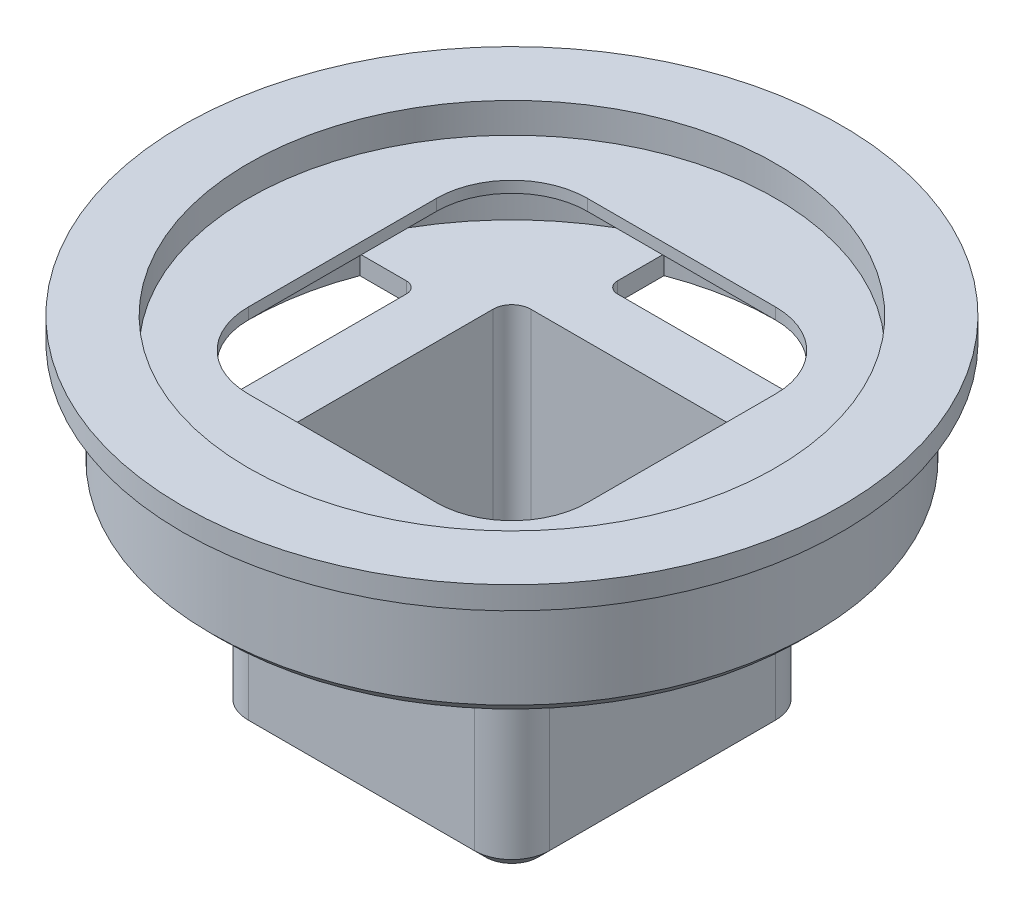
from build123d import *

# Parameters (mm, degrees)
SKETCH1_R                                           = 80
BOSS_EXTRUDE1_DEPTH                                 = 25
SKETCH2_R                                           = 80
SKETCH2_R_2                                         = 70
BOSS_EXTRUDE2_DEPTH                                 = 5
SKETCH3_R                                           = 87.5
SKETCH3_R_2                                         = 70
BOSS_EXTRUDE3_DEPTH                                 = 6
SKETCH5_W                                           = 80
SKETCH5_H                                           = 80
BOSS_EXTRUDE4_DEPTH                                 = 55
SHELL1_START                                        = -50
SHELL1_OUTLINE_W                                    = 70
SHELL1_OUTLINE_H                                    = 70
SHELL1_DEPTH                                        = 75
SHELL1_START_2                                      = 5
SHELL1_2_OUTLINE_R                                  = 75
SHELL1_2_OUTLINE_W                                  = 70
SHELL1_2_OUTLINE_H                                  = 70
SHELL1_2_DEPTH                                      = 20
F_6_3_6_3_DIAMETER_HOLE1_D                          = 6.3
F_6_3_6_3_DIAMETER_HOLE1_DEPTH                      = 10
F_6_3_6_3_DIAMETER_HOLE1_TIP                        = 1.89271095
SKETCH9_R                                           = 5.623813335
BOSS_EXTRUDE5_DEPTH                                 = 5
SKETCH11_R                                          = 70
BOSS_EXTRUDE6_DEPTH                                 = 3
CUT_EXTRUDE2_DEPTH                                  = 6
FILLET2_R                                           = 3
SKETCH18_R                                          = 15.880068884
BOSS_EXTRUDE9_DEPTH                                 = 5
SKETCH19_R                                          = 10
BOSS_EXTRUDE10_DEPTH                                = 10
CBORE_FOR_M6_HEX_SOCKET_HEAD_CAP_SCREW1_D           = 6.6
CBORE_FOR_M6_HEX_SOCKET_HEAD_CAP_SCREW1_CBORE_D     = 11
CBORE_FOR_M6_HEX_SOCKET_HEAD_CAP_SCREW1_CBORE_DEPTH = 6.4
FILLET7_R                                           = 10
FILLET8_R                                           = 5
CHAMFER1_SIZE                                       = 3


# Read off the part's stored shape, not the designer's step: Shell1
with BuildPart() as part:
    # Sketch1 → Boss-Extrude1 (new body)
    with BuildSketch(Plane(origin=(0, 0, 0), x_dir=(1, 0, 0), z_dir=(0, 1, 0))):
        with Locations(Location((0, 0, 0), (0, 0, 270))):
            Circle(SKETCH1_R)
    extrude(amount=BOSS_EXTRUDE1_DEPTH)

    # Sketch2 → Boss-Extrude2 (add)
    with BuildSketch(Plane(origin=(0, 25, 0), x_dir=(1, 0, 0), z_dir=(0, 1, 0))):
        with Locations(Location((0, 0, 0), (0, 0, 270))):
            Circle(SKETCH2_R)
        with Locations(Location((0, 0, 0), (0, 0, 270))):
            Circle(SKETCH2_R_2, mode=Mode.SUBTRACT)
    extrude(amount=BOSS_EXTRUDE2_DEPTH)

    # Sketch3 → Boss-Extrude3 (add)
    with BuildSketch(Plane(origin=(0, 30, 0), x_dir=(1, 0, 0), z_dir=(0, 1, 0))):
        with Locations(Location((0, 0, 0), (0, 0, 270))):
            Circle(SKETCH3_R)
        with Locations(Location((0, 0, 0), (0, 0, 270))):
            Circle(SKETCH3_R_2, mode=Mode.SUBTRACT)
    extrude(amount=BOSS_EXTRUDE3_DEPTH)

    # Sketch5 → Boss-Extrude4 (add)
    with BuildSketch(Plane.XZ):
        Rectangle(SKETCH5_W, SKETCH5_H)
    extrude(amount=BOSS_EXTRUDE4_DEPTH)

    # Shell1 outline → Shell1 (cut)
    with BuildSketch(Plane(origin=(0, 0, 0), x_dir=(1, 0, 0), z_dir=(0, 1, 0)).offset(SHELL1_START)):
        Rectangle(SHELL1_OUTLINE_W, SHELL1_OUTLINE_H)
    extrude(amount=SHELL1_DEPTH, mode=Mode.SUBTRACT)

    # Shell1 2 outline → Shell1 2 (cut)
    with BuildSketch(Plane(origin=(0, 0, 0), x_dir=(1, 0, 0), z_dir=(0, 1, 0)).offset(SHELL1_START_2)):
        Circle(SHELL1_2_OUTLINE_R)
        Rectangle(SHELL1_2_OUTLINE_W, SHELL1_2_OUTLINE_H, mode=Mode.SUBTRACT)
    extrude(amount=SHELL1_2_DEPTH, mode=Mode.SUBTRACT)

    # Ø6.3 (6.3) Diameter Hole1
    with Locations(Plane(origin=(0, -50, 0), x_dir=(1, 0, 0), z_dir=(0, 1, 0))):
        with Locations((0, 0), (24, -24), (-24, 24), (-24, -24), (24, 24), (8, -8), (-8, 8), (-8, -8), (8, 8), (8, 24), (24, 8), (-8, 24), (-24, 8), (-24, -8), (-8, -24), (8, -24), (24, -8)):
            Hole(F_6_3_6_3_DIAMETER_HOLE1_D / 2, depth=F_6_3_6_3_DIAMETER_HOLE1_DEPTH)
            with Locations((0, 0, -(F_6_3_6_3_DIAMETER_HOLE1_DEPTH + F_6_3_6_3_DIAMETER_HOLE1_TIP / 2))):  # 118° drill point
                Cone(0, F_6_3_6_3_DIAMETER_HOLE1_D / 2, F_6_3_6_3_DIAMETER_HOLE1_TIP, mode=Mode.SUBTRACT)

    # Sketch9 → Boss-Extrude5 (add)
    with BuildSketch(Plane(origin=(0, -50, 0), x_dir=(1, 0, 0), z_dir=(0, 1, 0))):
        Circle(SKETCH9_R)
    extrude(amount=-BOSS_EXTRUDE5_DEPTH)

    # Sketch11 → Boss-Extrude6 (add)
    with BuildSketch(Plane(origin=(0, 25, 0), x_dir=(1, 0, 0), z_dir=(0, 1, 0))):
        with Locations(Location((0, 0, 0), (0, 0, 270))):
            Circle(SKETCH11_R)
        with BuildLine():
            Line((-45, 25), (-45, -25))
            ThreePointArc((-45, -25), (-39.142135624, -39.142135624), (-25, -45))
            Line((-25, -45), (25, -45))
            ThreePointArc((25, -45), (39.142135624, -39.142135624), (45, -25))
            Line((45, -25), (45, 25))
            ThreePointArc((45, 25), (39.142135624, 39.142135624), (25, 45))
            Line((25, 45), (-25, 45))
            ThreePointArc((-25, 45), (-39.142135624, 39.142135624), (-45, 25))
        make_face(mode=Mode.SUBTRACT)
    extrude(amount=BOSS_EXTRUDE6_DEPTH)

    # Sketch12 → Cut-Extrude2 (cut)
    with BuildSketch(Plane.XZ):
        with BuildLine():
            Line((-50, 25), (-65.383484153, 25))
            ThreePointArc((-65.383484153, 25), (-70, 0), (-65.383484153, -25))
            Line((-65.383484153, -25), (-50, -25))
            Line((-50, -25), (-50, 25))
        make_face()
        with BuildLine():
            Line((-25, 50), (-25, 65.383484153))
            ThreePointArc((-25, 65.383484153), (0, 70), (25, 65.383484153))
            Line((25, 65.383484153), (25, 50))
            Line((25, 50), (-25, 50))
        make_face()
        with BuildLine():
            Line((50, 25), (65.383484153, 25))
            ThreePointArc((65.383484153, 25), (70, 0), (65.383484153, -25))
            Line((65.383484153, -25), (50, -25))
            Line((50, -25), (50, 25))
        make_face()
        with BuildLine():
            Line((25, -50), (-25, -50))
            Line((-25, -50), (-25, -65.383484153))
            ThreePointArc((-25, -65.383484153), (0, -70), (25, -65.383484153))
            Line((25, -65.383484153), (25, -50))
        make_face()
    extrude(amount=-CUT_EXTRUDE2_DEPTH, mode=Mode.SUBTRACT)

    # Fillet2
    fillet2_edges = [part.edges().sort_by_distance(p)[0] for p in [
        (-50, 2.5, 25),
        (-50, 2.5, -25),
        (25, 2.5, 50),
        (-25, 2.5, 50),
        (50, 2.5, -25),
        (50, 2.5, 25),
        (-25, 2.5, -50),
        (25, 2.5, -50),
    ]]
    fillet(fillet2_edges, radius=FILLET2_R)

    # Sketch18 → Boss-Extrude9 (add)
    with BuildSketch(Plane.XZ.offset(55)):
        Circle(SKETCH18_R)
    extrude(amount=-BOSS_EXTRUDE9_DEPTH)

    # Sketch19 → Boss-Extrude10 (add)
    with BuildSketch(Plane.XZ.offset(55)):
        with Locations(Location((0, 0, 0), (0, 0, 270))):
            Circle(SKETCH19_R)
    extrude(amount=-BOSS_EXTRUDE10_DEPTH)

    # CBORE for M6 Hex Socket Head Cap Screw1 (through all)
    with Locations(Plane(origin=(0, -55, 0), x_dir=(-1, 0, 0), z_dir=(0, -1, 0))):
        with Locations((0, 0)):
            CounterBoreHole(CBORE_FOR_M6_HEX_SOCKET_HEAD_CAP_SCREW1_D / 2, CBORE_FOR_M6_HEX_SOCKET_HEAD_CAP_SCREW1_CBORE_D / 2, CBORE_FOR_M6_HEX_SOCKET_HEAD_CAP_SCREW1_CBORE_DEPTH)

    # Fillet7
    fillet7_edges = [part.edges().sort_by_distance(p)[0] for p in [
        (40, -27.5, -40),
        (40, -27.5, 40),
        (-40, -27.5, 40),
        (-40, -27.5, -40),
    ]]
    fillet(fillet7_edges, radius=FILLET7_R)

    # Fillet8
    fillet8_edges = [part.edges().sort_by_distance(p)[0] for p in [
        (35, -22.5, -35),
        (35, -22.5, 35),
        (-35, -22.5, 35),
        (-35, -22.5, -35),
    ]]
    fillet(fillet8_edges, radius=FILLET8_R)

    # Chamfer1
    chamfer1_edges = [part.edges().sort_by_distance(p)[0] for p in [
        (0, 0, -80),
        (0, -55, -40),
        (-40, -55, 0),
        (40, -55, 0),
        (0, -55, 40),
        (-37.071067812, -55, 37.071067812),
        (37.071067812, -55, 37.071067812),
        (37.071067812, -55, -37.071067812),
        (-37.071067812, -55, -37.071067812),
    ]]
    chamfer(chamfer1_edges, length=CHAMFER1_SIZE)


solid = part.part
